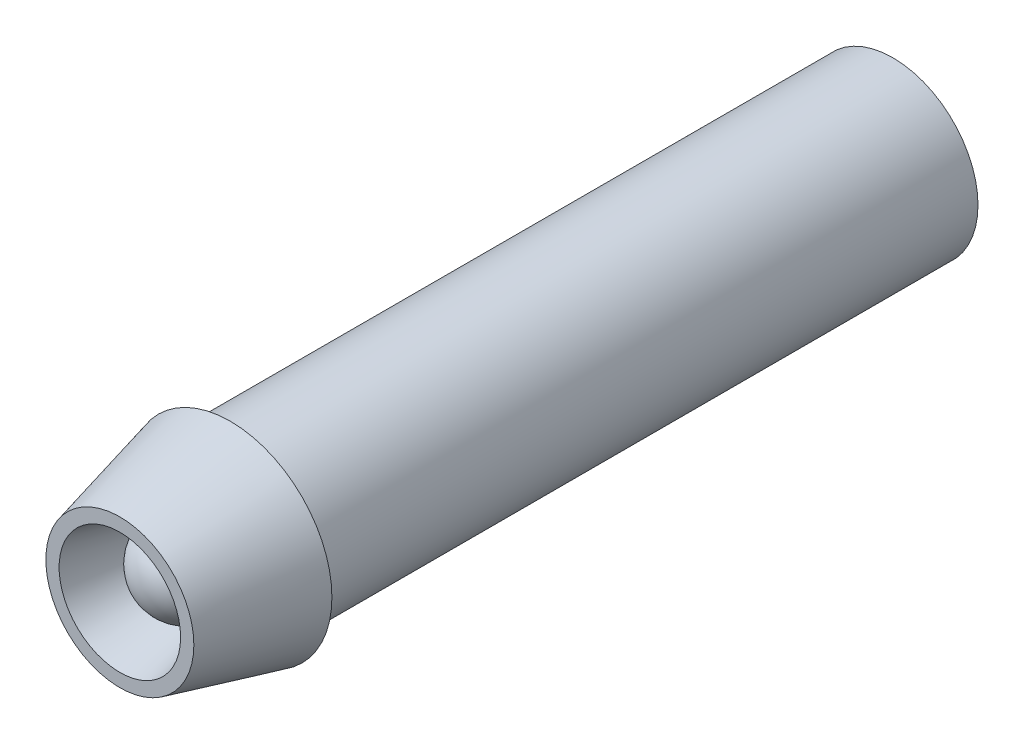
from build123d import *

# Parameters (mm, degrees)
ESQUISSE1_R        = 4.85
ESQUISSE1_R_2      = 2
BOSS_EXTRU_1_DEPTH = 5
CHANFREIN1_SIZE    = 6
CHANFREIN1_SIZE_2  = 1.5
CHANFREIN2_SIZE    = 0.75
CHANFREIN2_SIZE2   = 3
ESQUISSE4_R        = 2
BOSS_EXTRU_2_DEPTH = 2
CONG_1_R           = 2
ESQUISSE5_R        = 3.85
BOSS_EXTRU_3_DEPTH = 30


# Some blends are built 0.0001 mm under size
with BuildPart() as part:
    # Esquisse1 → Boss.-Extru.1 (new body)
    with BuildSketch(Plane.XY):
        Circle(ESQUISSE1_R)
        Circle(ESQUISSE1_R_2, mode=Mode.SUBTRACT)
    extrude(amount=BOSS_EXTRU_1_DEPTH)

    # Chanfrein1
    # the kernel refuses this chamfer: 6, 1.5 mm, written as the material it takes off along each edge
    with BuildSketch(Plane(origin=(0, 0, 5), x_dir=(1, 0, 0), z_dir=(0, -1, 0))) as chanfrein1_piece_1:
        Polygon((4.85, -CHANFREIN1_SIZE), (4.85 - CHANFREIN1_SIZE_2, 0), (4.85, 0), align=None)
    revolve(axis=Axis((0, 0, 5), (0, 0, 1)), mode=Mode.SUBTRACT)

    # Chanfrein2
    chanfrein2_edges = [part.edges().sort_by_distance(p)[0] for p in [
        (-2, 0, 5),
    ]]
    chanfrein2_side = [part.faces().sort_by_distance(p)[0] for p in [
        (-3.255247691, 0, 5),
    ]]
    chamfer(chanfrein2_edges, length=CHANFREIN2_SIZE, length2=CHANFREIN2_SIZE2, reference=chanfrein2_side[0])

    # Esquisse5 → Boss.-Extru.3 (add)
    with BuildSketch(Plane(origin=(0, 0, 0), x_dir=(-1, 0, 0), z_dir=(0, 0, -1))):
        with Locations(Location((0, 0, 0), (0, 0, 180))):
            Circle(ESQUISSE5_R)
    extrude(amount=BOSS_EXTRU_3_DEPTH)


with BuildPart() as body_2:
    # Esquisse4 → Boss.-Extru.2 (new body)
    with BuildSketch(Plane.XY.offset(2)):
        Circle(ESQUISSE4_R)
    extrude(amount=BOSS_EXTRU_2_DEPTH)

    # Congé1
    cong_1_edges = [body_2.edges().sort_by_distance(p)[0] for p in [
        (-2, 0, 4),
    ]]
    fillet(cong_1_edges, radius=CONG_1_R - 0.0001)  # a hair under: the kernel refuses the full size


solid = Compound([part.part, body_2.part])
